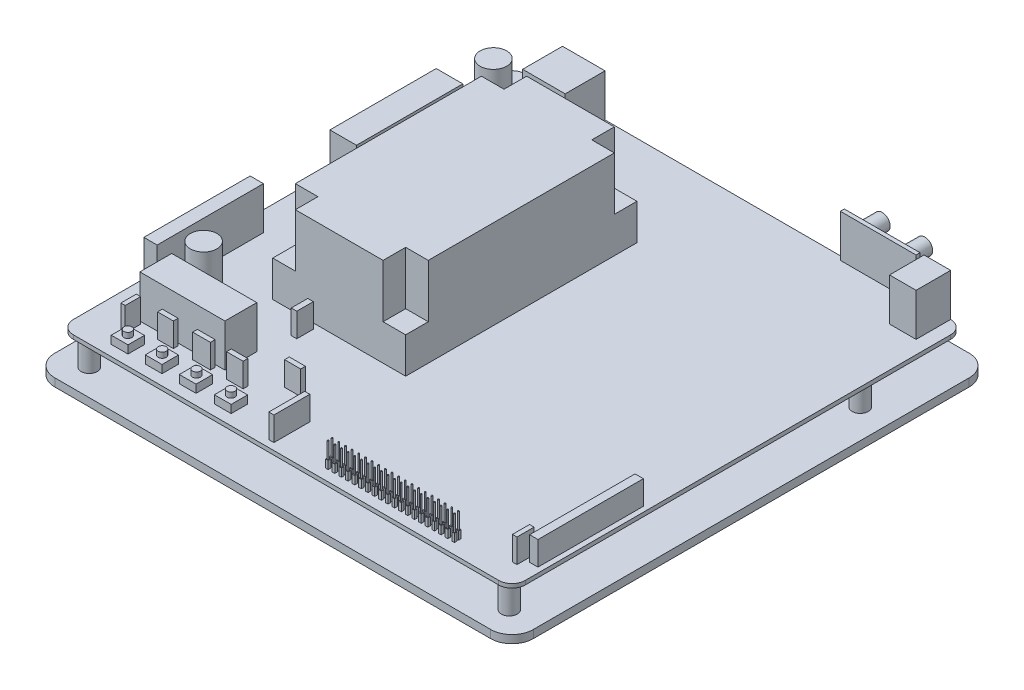
from build123d import *

# Parameters (mm, degrees)
RESSALTO_EXTRUS_O1_DEPTH  = 3
ESBO_O2_R                 = 3.5
RESSALTO_EXTRUS_O2_DEPTH  = 5
ESBO_O3_R                 = 3
RESSALTO_EXTRUS_O3_DEPTH  = 11
RESSALTO_EXTRUS_O4_DEPTH  = 1.5
ESBO_O5_W                 = 50
ESBO_O5_H                 = 87
RESSALTO_EXTRUS_O5_DEPTH  = 33.5
ESBO_O6_W                 = 8.5
ESBO_O6_H                 = 8.5
CORTE_EXTRUS_O1_DEPTH     = 20
ESBO_O7_W                 = 6.3
ESBO_O7_H                 = 6.2
RESSALTO_EXTRUS_O6_DEPTH  = 3
ESBO_O8_R                 = 1.5
RESSALTO_EXTRUS_O7_DEPTH  = 2
ESBO_O9_W                 = 1
ESBO_O9_H                 = 1
RESSALTO_EXTRUS_O8_DEPTH  = 3
ESBO_O10_R                = 0.25
RESSALTO_EXTRUS_O9_DEPTH  = 6
PADR_O_LINEAR1_COUNT      = 20
PADR_O_LINEAR1_PITCH      = 2.5
PADR_O_LINEAR1_COUNT_DIR2 = 2
PADR_O_LINEAR1_PITCH_DIR2 = 1.5
ESBO_O11_R                = 5
ESBO_O11_W                = 32
ESBO_O11_H                = 12
ESBO_O11_W_2              = 5
ESBO_O11_H_2              = 40
ESBO_O11_W_3              = 10
ESBO_O11_W_4              = 16
ESBO_O11_H_3              = 15
ESBO_O11_H_4              = 13
ESBO_O11_W_5              = 28.5
ESBO_O11_H_5              = 1.5
RESSALTO_EXTRUS_O10_DEPTH = 16
ESBO_O12_R                = 3
RESSALTO_EXTRUS_O11_DEPTH = 8
ESBO_O13_W                = 1.63158932
ESBO_O13_H                = 5.78472577
ESBO_O13_W_2              = 5.933052072
ESBO_O13_H_2              = 1.779915621
ESBO_O13_W_3              = 6.674683581
ESBO_O13_W_4              = 6.229704676
ESBO_O13_W_5              = 1.928241924
ESBO_O13_H_3              = 13.497693464
ESBO_O13_W_6              = 6.081378375
ESBO_O13_H_4              = 1.779915622
ESBO_O13_W_7              = 2.076568226
ESBO_O13_H_5              = 6.229704676
ESBO_O13_W_8              = 3.125695858
ESBO_O13_H_6              = 39.6558734
ESBO_O13_W_9              = 1.699808413
ESBO_O13_H_7              = 6.437326086
RESSALTO_EXTRUS_O12_DEPTH = 9


with BuildPart() as part:
    # Esboço1 → Ressalto-extrusão1 (new body)
    with BuildSketch(Plane(origin=(0, 0, 0), x_dir=(1, 0, 0), z_dir=(0, 1, 0))):
        with BuildLine():
            Line((82, -90), (-82, -90))
            ThreePointArc((-82, -90), (-87.656854249, -87.656854249), (-90, -82))
            Line((-90, -82), (-90, 82))
            ThreePointArc((-90, 82), (-87.656854249, 87.656854249), (-82, 90))
            Line((-82, 90), (82, 90))
            ThreePointArc((82, 90), (87.656854249, 87.656854249), (90, 82))
            Line((90, 82), (90, -82))
            ThreePointArc((90, -82), (87.656854249, -87.656854249), (82, -90))
        make_face()
    extrude(amount=RESSALTO_EXTRUS_O1_DEPTH)

    # Esboço2 → Ressalto-extrusão2 (add)
    with BuildSketch(Plane(origin=(0, 0, 0), x_dir=(-1, 0, 0), z_dir=(0, -1, 0))):
        with Locations((79, -62)):
            Circle(ESBO_O2_R)
        with Locations((-79, -62)):
            Circle(ESBO_O2_R)
        with Locations((-79, 62)):
            Circle(ESBO_O2_R)
        with Locations((79, 62)):
            Circle(ESBO_O2_R)
    extrude(amount=RESSALTO_EXTRUS_O2_DEPTH)

    # Esboço3 → Ressalto-extrusão3 (add)
    with BuildSketch(Plane(origin=(0, 3, 0), x_dir=(1, 0, 0), z_dir=(0, 1, 0))):
        with Locations((-79, -80)):
            Circle(ESBO_O3_R)
        with Locations((-79, 75)):
            Circle(ESBO_O3_R)
        with Locations((79, 52)):
            Circle(ESBO_O3_R)
        with Locations((79, -80)):
            Circle(ESBO_O3_R)
    extrude(amount=RESSALTO_EXTRUS_O3_DEPTH)

    # Esboço4 → Ressalto-extrusão4 (add)
    with BuildSketch(Plane(origin=(0, 14, 0), x_dir=(1, 0, 0), z_dir=(0, 1, 0))):
        with BuildLine():
            Line((-80, 85), (80, 85))
            ThreePointArc((80, 85), (83.535533906, 83.535533906), (85, 80))
            Line((85, 80), (85, -80))
            ThreePointArc((85, -80), (83.535533906, -83.535533906), (80, -85))
            Line((80, -85), (-80, -85))
            ThreePointArc((-80, -85), (-83.535533906, -83.535533906), (-85, -80))
            Line((-85, -80), (-85, 80))
            ThreePointArc((-85, 80), (-83.535533906, 83.535533906), (-80, 85))
        make_face()
    extrude(amount=RESSALTO_EXTRUS_O4_DEPTH)

    # Esboço5 → Ressalto-extrusão5 (add)
    with BuildSketch(Plane(origin=(0, 15.5, 0), x_dir=(1, 0, 0), z_dir=(0, 1, 0))):
        with Locations((-29, 7.5)):
            Rectangle(ESBO_O5_W, ESBO_O5_H)
    extrude(amount=RESSALTO_EXTRUS_O5_DEPTH)

    # Esboço6 → Corte-extrusão1 (cut)
    with BuildSketch(Plane(origin=(0, 49, 0), x_dir=(1, 0, 0), z_dir=(0, 1, 0))):
        with Locations((-49.75, -31.75)):
            Rectangle(ESBO_O6_W, ESBO_O6_H)
        with Locations((-8.25, -31.75)):
            Rectangle(ESBO_O6_W, ESBO_O6_H)
        with Locations((-8.25, 46.75)):
            Rectangle(ESBO_O6_W, ESBO_O6_H)
        with Locations((-49.75, 46.75)):
            Rectangle(ESBO_O6_W, ESBO_O6_H)
    extrude(amount=-CORTE_EXTRUS_O1_DEPTH, mode=Mode.SUBTRACT)

    # Esboço7 → Ressalto-extrusão6 (add)
    with BuildSketch(Plane(origin=(0, 15.5, 0), x_dir=(1, 0, 0), z_dir=(0, 1, 0))):
        with Locations((-27.8, -77.9)):
            Rectangle(ESBO_O7_W, ESBO_O7_H)
        with Locations((-66.6, -77.9)):
            Rectangle(ESBO_O7_W, ESBO_O7_H)
        with Locations((-53.8, -77.9)):
            Rectangle(ESBO_O7_W, ESBO_O7_H)
        with Locations((-41, -77.9)):
            Rectangle(ESBO_O7_W, ESBO_O7_H)
    extrude(amount=RESSALTO_EXTRUS_O6_DEPTH)

    # Esboço8 → Ressalto-extrusão7 (add)
    with BuildSketch(Plane(origin=(0, 18.5, 0), x_dir=(1, 0, 0), z_dir=(0, 1, 0))):
        with Locations((-66.6, -77.9)):
            Circle(ESBO_O8_R)
        with Locations((-53.7, -77.9)):
            Circle(ESBO_O8_R)
        with Locations((-40.8, -77.9)):
            Circle(ESBO_O8_R)
        with Locations((-27.75, -77.95)):
            Circle(ESBO_O8_R)
    extrude(amount=RESSALTO_EXTRUS_O7_DEPTH)

    # Esboço9 → Ressalto-extrusão8 (add)
    with BuildSketch(Plane(origin=(0, 15.5, 0), x_dir=(1, 0, 0), z_dir=(0, 1, 0))):
        with Locations((11.35, -80.5)):
            Rectangle(ESBO_O9_W, ESBO_O9_H)
    ressalto_extrus_o8 = extrude(amount=RESSALTO_EXTRUS_O8_DEPTH)

    # Esboço10 → Ressalto-extrusão9 (add)
    with BuildSketch(Plane(origin=(0, 18.5, 0), x_dir=(1, 0, 0), z_dir=(0, 1, 0))):
        with Locations((11.35, -80.5)):
            Circle(ESBO_O10_R)
    ressalto_extrus_o9 = extrude(amount=RESSALTO_EXTRUS_O9_DEPTH)

    # Padrão linear1: Ressalto-extrusão8, Ressalto-extrus_o9 20 × 2
    with Locations(*[(i * PADR_O_LINEAR1_PITCH, 0, -j * PADR_O_LINEAR1_PITCH_DIR2) for i in range(PADR_O_LINEAR1_COUNT) for j in range(PADR_O_LINEAR1_COUNT_DIR2) if (i, j) != (0, 0)]):
        add(ressalto_extrus_o8)
        add(ressalto_extrus_o9)

    # Esboço11 → Ressalto-extrusão10 (add)
    with BuildSketch(Plane(origin=(0, 15.5, 0), x_dir=(1, 0, 0), z_dir=(0, 1, 0))):
        with Locations((-70, -46)):
            Circle(ESBO_O11_R)
        with Locations((-75, 68)):
            Circle(ESBO_O11_R)
        with Locations((-55.996597933, -62)):
            Rectangle(ESBO_O11_W, ESBO_O11_H)
        with Locations((-80, -36)):
            Rectangle(ESBO_O11_W_2, ESBO_O11_H_2)
        with Locations((-77.5, 34)):
            Rectangle(ESBO_O11_W_3, ESBO_O11_H_2)
        with Locations((-58, 77.5)):
            Rectangle(ESBO_O11_W_4, ESBO_O11_H_3)
        with Locations((75, 78.5)):
            Rectangle(ESBO_O11_W_3, ESBO_O11_H_4)
        with Locations((54.25, 84.25)):
            Rectangle(ESBO_O11_W_5, ESBO_O11_H_5)
    extrude(amount=RESSALTO_EXTRUS_O10_DEPTH)

    # Esboço12 → Ressalto-extrusão11 (add)
    with BuildSketch(Plane(origin=(0, 0, -85), x_dir=(-1, 0, 0), z_dir=(0, 0, -1))):
        with Locations((-62.25, 26.5)):
            Circle(ESBO_O12_R)
        with Locations((-46.25, 26.5)):
            Circle(ESBO_O12_R)
    extrude(amount=RESSALTO_EXTRUS_O11_DEPTH)

    # Esboço13 → Ressalto-extrusão12 (add)
    with BuildSketch(Plane(origin=(0, 15.5, 0), x_dir=(1, 0, 0), z_dir=(0, 1, 0))):
        with Locations((-71.610074729, -71.799389553)):
            Rectangle(ESBO_O13_W, ESBO_O13_H)
        with Locations((-59.669807433, -69.796984479)):
            Rectangle(ESBO_O13_W_2, ESBO_O13_H_2)
        with Locations((-46.097950818, -69.796984479)):
            Rectangle(ESBO_O13_W_3, ESBO_O13_H_2)
        with Locations((-33.564378314, -69.796984479)):
            Rectangle(ESBO_O13_W_4, ESBO_O13_H_2)
        with Locations((-8.126417554, -75.6558734)):
            Rectangle(ESBO_O13_W_5, ESBO_O13_H_3)
        with Locations((-20.140848001, -61.490711577)):
            Rectangle(ESBO_O13_W_6, ESBO_O13_H_4)
        with Locations((-37.717514765, -41.170008229)):
            Rectangle(ESBO_O13_W_7, ESBO_O13_H_5)
        with Locations((81.512220505, -53.483128012)):
            Rectangle(ESBO_O13_W_8, ESBO_O13_H_6)
        with Locations((77.452286259, -73.22538484)):
            Rectangle(ESBO_O13_W_9, ESBO_O13_H_7)
    extrude(amount=RESSALTO_EXTRUS_O12_DEPTH)


solid = part.part
